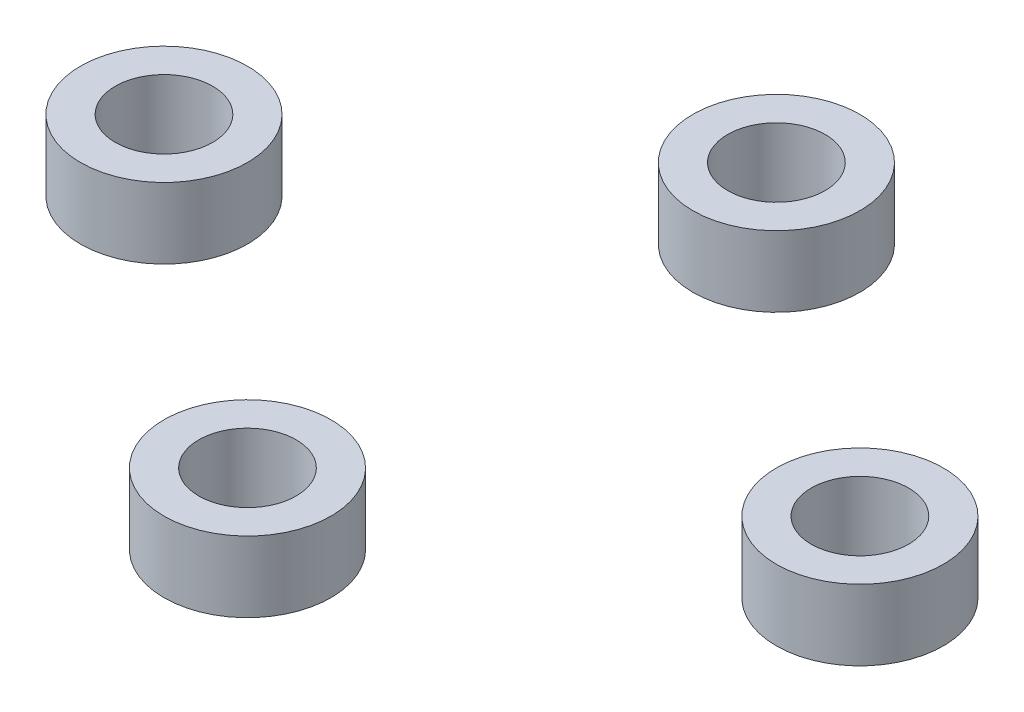
from build123d import *

# Parameters (mm, degrees)
SKETCH1_R             = 3
SKETCH1_R_2           = 1.75
BOSS_EXTRUDE1_DEPTH   = 1.27
BOSS_EXTRUDE1_2_DEPTH = 1.27
BOSS_EXTRUDE1_3_DEPTH = 1.27
BOSS_EXTRUDE1_4_DEPTH = 1.27


with BuildPart() as part:
    # Sketch1 → Boss-Extrude1 (new, symmetric)
    with BuildSketch(Plane(origin=(0, 0, 0), x_dir=(1, 0, 0), z_dir=(0, 1, 0))):
        with Locations((-13.27711142, 0)):
            Circle(SKETCH1_R)
        with Locations((-13.27711142, 0)):
            Circle(SKETCH1_R_2, mode=Mode.SUBTRACT)
    extrude(amount=BOSS_EXTRUDE1_DEPTH, both=True)


with BuildPart() as body_2:
    # Sketch1 → Boss-Extrude1 2 (new, symmetric)
    with BuildSketch(Plane(origin=(0, 0, 0), x_dir=(1, 0, 0), z_dir=(0, 1, 0))):
        with Locations((-0.77711142, 9.5)):
            Circle(SKETCH1_R)
        with Locations((-0.77711142, 9.5)):
            Circle(SKETCH1_R_2, mode=Mode.SUBTRACT)
    extrude(amount=BOSS_EXTRUDE1_2_DEPTH, both=True)


with BuildPart() as body_3:
    # Sketch1 → Boss-Extrude1 3 (new, symmetric)
    with BuildSketch(Plane(origin=(0, 0, 0), x_dir=(1, 0, 0), z_dir=(0, 1, 0))):
        with Locations((11.72288858, 0)):
            Circle(SKETCH1_R)
        with Locations((11.72288858, 0)):
            Circle(SKETCH1_R_2, mode=Mode.SUBTRACT)
    extrude(amount=BOSS_EXTRUDE1_3_DEPTH, both=True)


with BuildPart() as body_4:
    # Sketch1 → Boss-Extrude1 4 (new, symmetric)
    with BuildSketch(Plane(origin=(0, 0, 0), x_dir=(1, 0, 0), z_dir=(0, 1, 0))):
        with Locations((-0.77711142, -9.5)):
            Circle(SKETCH1_R)
        with Locations((-0.77711142, -9.5)):
            Circle(SKETCH1_R_2, mode=Mode.SUBTRACT)
    extrude(amount=BOSS_EXTRUDE1_4_DEPTH, both=True)


solid = Compound([part.part, body_2.part, body_3.part, body_4.part])
